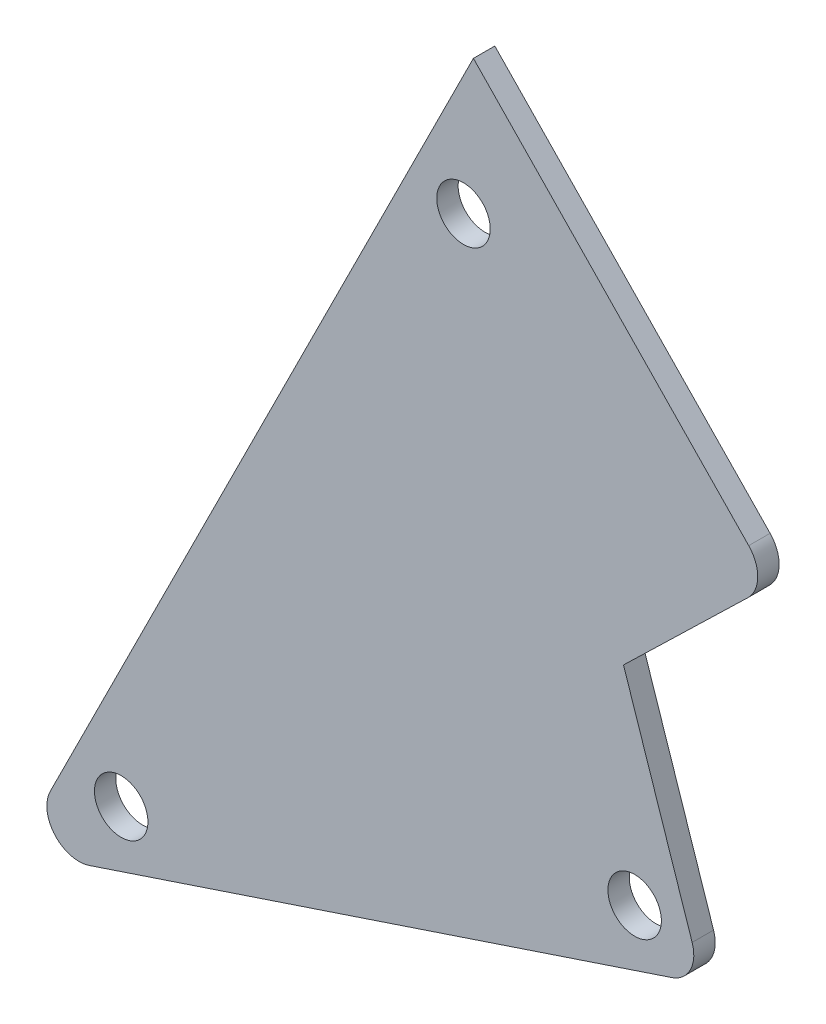
from build123d import *

# Parameters (mm, degrees)
SKETCH1_R           = 3.175
BOSS_EXTRUDE1_DEPTH = 2.54
FILLET1_R           = 3.81


with BuildPart() as part:
    # Sketch1 → Boss-Extrude1 (new body)
    with BuildSketch(Plane.XY):
        Polygon((-19.143713703, 97.831604251), (-73.495511623, -10.871991588), (8.032185257, 16.303907372), (-1.324519195, 44.374020727), (16.193552526, 61.336157748), align=None)
        with Locations((-60.96, 0)):
            Circle(SKETCH1_R, mode=Mode.SUBTRACT)
        with Locations((0, 20.32)):
            Circle(SKETCH1_R, mode=Mode.SUBTRACT)
        with Locations((-20.32, 81.28)):
            Circle(SKETCH1_R, mode=Mode.SUBTRACT)
    extrude(amount=BOSS_EXTRUDE1_DEPTH)

    # Fillet1
    fillet1_edges = [part.edges().sort_by_distance(p)[0] for p in [
        (-73.495511623, -10.871991588, 1.27),
        (8.032185257, 16.303907372, 1.27),
        (16.193552526, 61.336157748, 1.27),
    ]]
    fillet(fillet1_edges, radius=FILLET1_R)


solid = part.part
